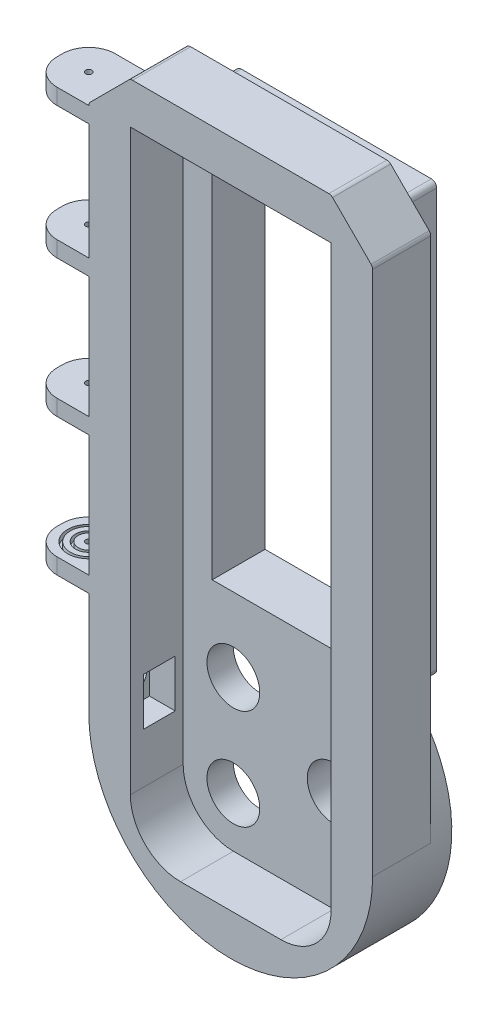
from build123d import *
from build123d.topology import SkipClean

# Parameters (mm, degrees)
CROQUIS1_W               = 27
CROQUIS1_H               = 72
CROQUIS1_R               = 5
SALIENTE_EXTRUIR1_DEPTH  = 5
CROQUIS2_W               = 38
CROQUIS2_H               = 81
CROQUIS2_W_2             = 27
CROQUIS2_H_2             = 72
SALIENTE_EXTRUIR2_DEPTH  = 5
SALIENTE_EXTRUIR9_START  = -1
SALIENTE_EXTRUIR9_DEPTH  = 1
SALIENTE_EXTRUIR10_DEPTH = 11
SALIENTE_EXTRUIR11_DEPTH = 10
REDONDEO1_R              = 1
REDONDEO2_R              = 1
REDONDEO3_R              = 1
CROQUIS6_W               = 6
CROQUIS6_H               = 9
CORTAR_EXTRUIR1_DEPTH    = 8
CROQUIS7_W               = 6
CROQUIS7_H               = 9
CROQUIS7_R               = 2.5
SALIENTE_EXTRUIR12_DEPTH = 3
CROQUIS8_W               = 11
CROQUIS8_H               = 3
SALIENTE_EXTRUIR13_DEPTH = 11
REDONDEO4_R              = 5
CROQUIS9_R               = 0.6
CORTAR_EXTRUIR2_DEPTH    = 80
SALIENTE_EXTRUIR14_START = -2
CROQUIS10_R              = 0.6
SALIENTE_EXTRUIR14_DEPTH = 2
CROQUIS11_R              = 4
CROQUIS11_R_2            = 3.5
CROQUIS11_R_3            = 2.5
CROQUIS11_R_4            = 2
CORTAR_EXTRUIR3_DEPTH    = 1


with BuildPart() as part:
    # Croquis1 → Saliente-Extruir1 (new body)
    with BuildSketch(Plane.XY):
        with BuildLine():
            Line((-19, 40.5), (-19, -40.5))
            ThreePointArc((-19, -40.5), (0, -86.370057685), (19, -40.5))
            Line((19, -40.5), (19, 40.5))
            Line((19, 40.5), (-19, 40.5))
        make_face()
        Rectangle(CROQUIS1_W, CROQUIS1_H, mode=Mode.SUBTRACT)
        with Locations((9.5, -59.5)):
            Circle(CROQUIS1_R, mode=Mode.SUBTRACT)
        with Locations((-9.5, -69)):
            Circle(CROQUIS1_R, mode=Mode.SUBTRACT)
        with Locations((-9.5, -50)):
            Circle(CROQUIS1_R, mode=Mode.SUBTRACT)
    extrude(amount=SALIENTE_EXTRUIR1_DEPTH)

    # Croquis2 → Saliente-Extruir2 (add)
    with BuildSketch(Plane(origin=(0, 0, 0), x_dir=(-1, 0, 0), z_dir=(0, 0, -1))):
        Rectangle(CROQUIS2_W, CROQUIS2_H)
        Rectangle(CROQUIS2_W_2, CROQUIS2_H_2, mode=Mode.SUBTRACT)
    extrude(amount=SALIENTE_EXTRUIR2_DEPTH)

    # Croquis3 → Saliente-Extruir9 (add)
    with BuildSketch(Plane.XY.offset(5).offset(SALIENTE_EXTRUIR9_START)):
        with BuildLine():
            Line((26.870057685, -59.5), (26.870057685, 40.5))
            Line((26.870057685, 40.5), (19, 48.370057685))
            Line((19, 48.370057685), (-19, 48.370057685))
            Line((-19, 48.370057685), (-26.870057685, 40.5))
            Line((-26.870057685, 40.5), (-26.870057685, -59.5))
            ThreePointArc((-26.870057685, -59.5), (0, -86.370057685), (26.870057685, -59.5))
        make_face()
        with BuildLine():
            Line((19, -59.5), (19, 40.5))
            Line((19, 40.5), (-19, 40.5))
            Line((-19, 40.5), (-19, -59.5))
            ThreePointArc((-19, -59.5), (0, -78.5), (19, -59.5))
        make_face(mode=Mode.SUBTRACT)
    extrude(amount=SALIENTE_EXTRUIR9_DEPTH)

    # Croquis4 → Saliente-Extruir10 (add)
    with BuildSketch(Plane(origin=(0, 0, 4), x_dir=(-1, 0, 0), z_dir=(0, 0, -1))):
        with BuildLine():
            Line((-19, -40.5), (-19, 40.5))
            Line((-19, 40.5), (19, 40.5))
            Line((19, 40.5), (19, -40.5))
            ThreePointArc((19, -40.5), (24.824696333, -49.217274097), (26.870057685, -59.5))
            Line((26.870057685, -59.5), (26.870057685, 40.5))
            Line((26.870057685, 40.5), (19, 48.370057685))
            Line((19, 48.370057685), (-19, 48.370057685))
            Line((-19, 48.370057685), (-26.870057685, 40.5))
            Line((-26.870057685, 40.5), (-26.870057685, -59.5))
            ThreePointArc((-26.870057685, -59.5), (-24.824696333, -49.217274097), (-19, -40.5))
        make_face()
    extrude(amount=-SALIENTE_EXTRUIR10_DEPTH)

    # Croquis5 → Saliente-Extruir11 (add)
    with SkipClean():  # the faces are left unmerged after this step: merging them gives an invalid solid
        with BuildSketch(Plane.XY.offset(5)):
            with BuildLine():
                Line((-19, -59.5), (-19, -69))
                ThreePointArc((-19, -69), (-16.217514421, -75.717514421), (-9.5, -78.5))
                Line((-9.5, -78.5), (9.5, -78.5))
                ThreePointArc((9.5, -78.5), (16.217514421, -75.717514421), (19, -69))
                Line((19, -69), (19, -59.5))
                Line((19, -59.5), (19, -40.5))
                ThreePointArc((19, -40.5), (0, -86.370057685), (-19, -40.5))
                Line((-19, -40.5), (-19, -59.5))
            make_face()
        extrude(amount=SALIENTE_EXTRUIR11_DEPTH)

    # Redondeo1
    redondeo1_edges = [part.edges().sort_by_distance(p)[0] for p in [
        (-19, -40.5, -2.5),
        (-19, 40.5, -0.5),
        (19, 40.5, -0.5),
        (19, -40.5, -2.5),
    ]]
    fillet(redondeo1_edges, radius=REDONDEO1_R)

    # Redondeo2
    redondeo2_edges = [part.edges().sort_by_distance(p)[0] for p in [
        (-18.707106781, 40.207106781, 4),
        (18.707106781, 40.207106781, 4),
        (-19, -0.5, 4),
        (0, 40.5, 4),
        (19, -0.5, 4),
    ]]
    fillet(redondeo2_edges, radius=REDONDEO2_R)

    # Redondeo3
    redondeo3_edges = [part.edges().sort_by_distance(p)[0] for p in [
        (-26.870057685, 40.5, 9.5),
        (-19, 48.370057685, 9.5),
        (26.870057685, 40.5, 9.5),
        (19, 48.370057685, 9.5),
    ]]
    fillet(redondeo3_edges, radius=REDONDEO3_R)

    # Croquis6 → Cortar-Extruir1 (cut)
    with SkipClean():  # the faces are left unmerged after this step: merging them gives an invalid solid
        with BuildSketch(Plane.ZY.offset(26.870057685)):
            with Locations((9.5, -55)):
                Rectangle(CROQUIS6_W, CROQUIS6_H)
        extrude(amount=-CORTAR_EXTRUIR1_DEPTH, mode=Mode.SUBTRACT)

    # Croquis7 → Saliente-Extruir12 (add)
    with SkipClean():  # the faces are left unmerged after this step: merging them gives an invalid solid
        with BuildSketch(Plane.ZY.offset(26.870057685)):
            with Locations((9.5, -55)):
                Rectangle(CROQUIS7_W, CROQUIS7_H)
            with Locations((9.5, -55)):
                Circle(CROQUIS7_R, mode=Mode.SUBTRACT)
        extrude(amount=-SALIENTE_EXTRUIR12_DEPTH)

    # Croquis8 → Saliente-Extruir13 (add)
    with SkipClean():  # the faces are left unmerged after this step: merging them gives an invalid solid
        with BuildSketch(Plane.ZY.offset(26.870057685)):
            with Locations((9.5, 38.585786438)):
                Rectangle(CROQUIS8_W, CROQUIS8_H)
            with Locations((9.5, 13.585786438)):
                Rectangle(CROQUIS8_W, CROQUIS8_H)
            with Locations((9.5, -12.414213562)):
                Rectangle(CROQUIS8_W, CROQUIS8_H)
            with Locations((9.5, -38.414213562)):
                Rectangle(CROQUIS8_W, CROQUIS8_H)
        extrude(amount=SALIENTE_EXTRUIR13_DEPTH)

    # Redondeo4
    redondeo4_edges = [part.edges().sort_by_distance(p)[0] for p in [
        (-37.870057685, -38.414213562, 4),
        (-37.870057685, -38.414213562, 15),
        (-37.870057685, -12.414213562, 4),
        (-37.870057685, -12.414213562, 15),
        (-37.870057685, 13.585786438, 4),
        (-37.870057685, 13.585786438, 15),
        (-37.870057685, 38.585786438, 4),
        (-37.870057685, 38.585786438, 15),
    ]]
    fillet(redondeo4_edges, radius=REDONDEO4_R)

    # Croquis9 → Cortar-Extruir2 (cut)
    with SkipClean():  # the faces are left unmerged after this step: merging them gives an invalid solid
        with BuildSketch(Plane(origin=(0, 40.085786438, 0), x_dir=(1, 0, 0), z_dir=(0, 1, 0))):
            with Locations((-32.370057685, -9.5)):
                Circle(CROQUIS9_R)
        extrude(amount=-CORTAR_EXTRUIR2_DEPTH, mode=Mode.SUBTRACT)

    # Croquis10 → Saliente-Extruir14 (add)
    with SkipClean():  # the faces are left unmerged after this step: merging them gives an invalid solid
        with BuildSketch(Plane.XZ.offset(39.914213562).offset(SALIENTE_EXTRUIR14_START)):
            with Locations((-32.370057685, 9.5)):
                Circle(CROQUIS10_R)
        extrude(amount=SALIENTE_EXTRUIR14_DEPTH)

    # Croquis11 → Cortar-Extruir3 (cut)
    # profile 1 of 2: a face of its own
    with SkipClean():  # the faces are left unmerged after this step: merging them gives an invalid solid
        with BuildSketch(Plane(origin=(0, -36.914213562, 0), x_dir=(1, 0, 0), z_dir=(0, 1, 0))):
            with Locations((-32.370057685, -9.5)):
                Circle(CROQUIS11_R)
            with Locations((-32.370057685, -9.5)):
                Circle(CROQUIS11_R_2, mode=Mode.SUBTRACT)
        # profile 2 of 2: a face of its own
        with BuildSketch(Plane(origin=(0, -36.914213562, 0), x_dir=(1, 0, 0), z_dir=(0, 1, 0))):
            with Locations((-32.370057685, -9.5)):
                Circle(CROQUIS11_R_3)
            with Locations((-32.370057685, -9.5)):
                Circle(CROQUIS11_R_4, mode=Mode.SUBTRACT)
        extrude(amount=-CORTAR_EXTRUIR3_DEPTH, mode=Mode.SUBTRACT)


solid = part.part
